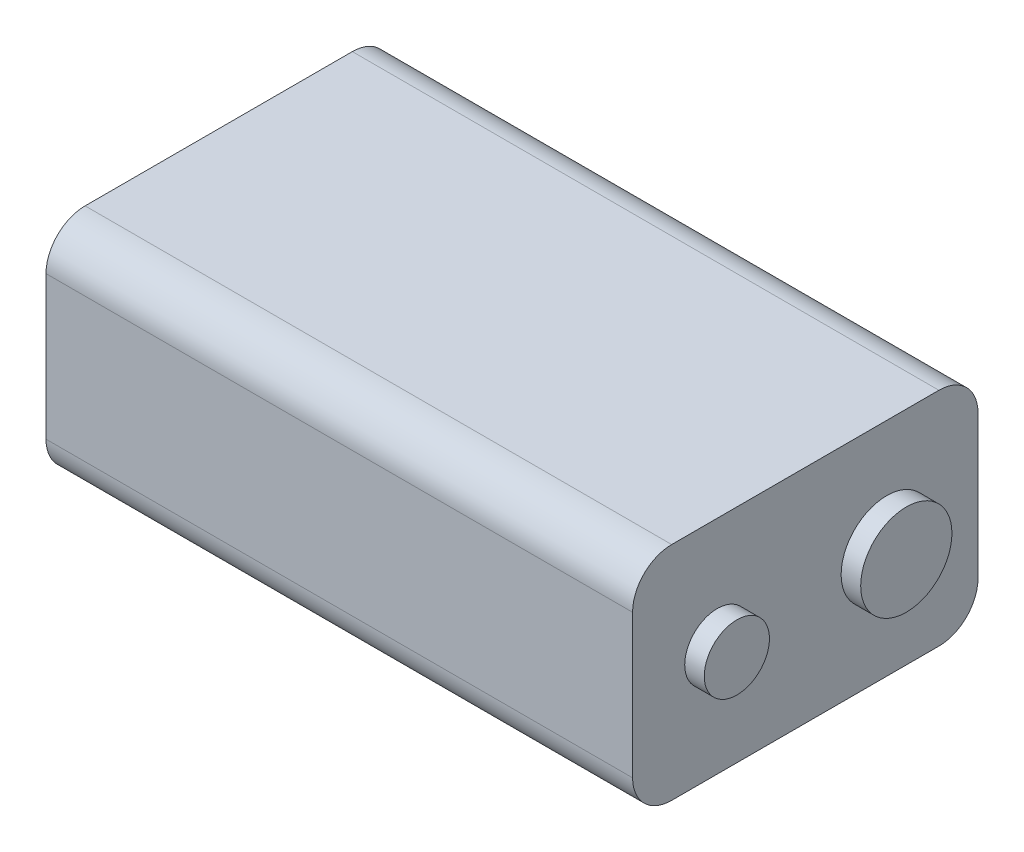
from build123d import *

# Parameters (mm, degrees)
SKETCH1_W           = 45
SKETCH1_H           = 26.5
BOSS_EXTRUDE1_DEPTH = 17
FILLET1_R           = 3
SKETCH2_R           = 3.5
SKETCH2_R_2         = 2.5
BOSS_EXTRUDE2_DEPTH = 1.5


with BuildPart() as part:
    # Sketch1 → Boss-Extrude1 (new body)
    with BuildSketch(Plane(origin=(0, 0, 0), x_dir=(1, 0, 0), z_dir=(0, 1, 0))):
        with Locations((0.552556883, 5.047981579)):
            Rectangle(SKETCH1_W, SKETCH1_H)
    extrude(amount=BOSS_EXTRUDE1_DEPTH)

    # Fillet1
    fillet1_edges = [part.edges().sort_by_distance(p)[0] for p in [
        (0.552556883, 17, -18.297981579),
        (0.552556883, 0, -18.297981579),
        (0.552556883, 0, 8.202018421),
        (0.552556883, 17, 8.202018421),
    ]]
    fillet(fillet1_edges, radius=FILLET1_R)

    # Sketch2 → Boss-Extrude2 (add)
    with BuildSketch(Plane(origin=(23.052556883, 0, 0), x_dir=(0, 0, -1), z_dir=(1, 0, 0))):
        with Locations((11.297981579, 8.5)):
            Circle(SKETCH2_R)
        with Locations((-1.702018421, 8.5)):
            Circle(SKETCH2_R_2)
    extrude(amount=BOSS_EXTRUDE2_DEPTH)


solid = part.part
